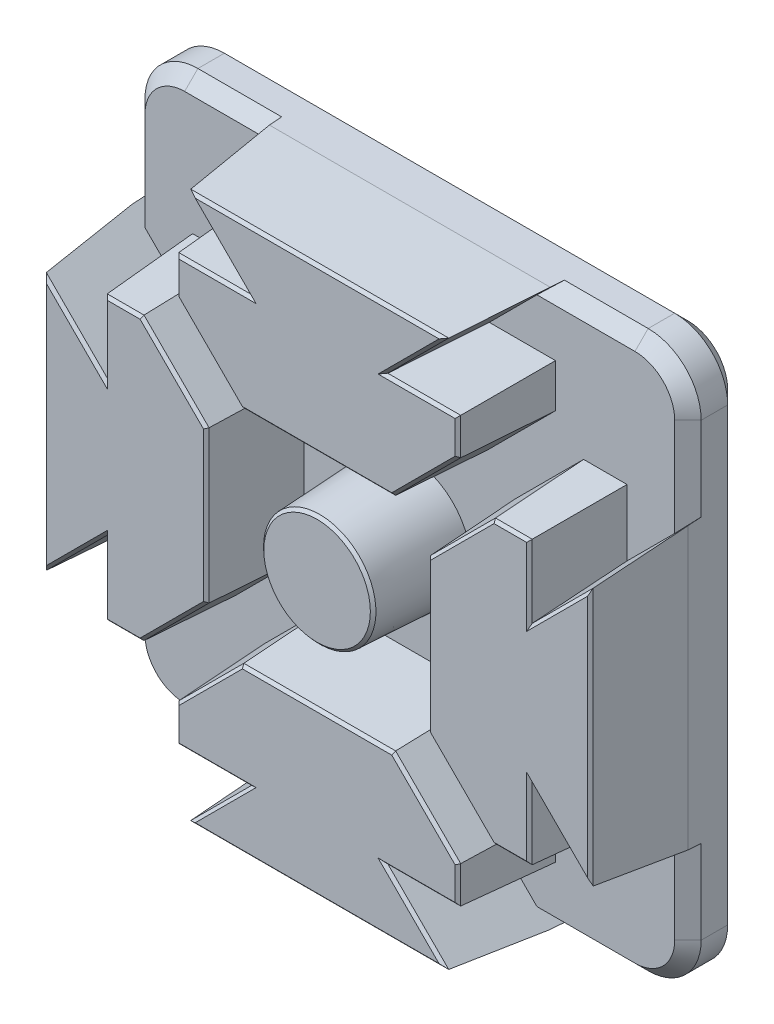
from build123d import *
from OCP.BRepFilletAPI import BRepFilletAPI_MakeChamfer

# Parameters (mm, degrees)
RESSALTO_EXTRUS_O1_DEPTH           = 2
ESBO_O4_R                          = 2.3
RESSALTO_EXTRUS_O2_DEPTH           = 3.5
RESSALTO_EXTRUS_O2_DRAFT           = 3
RESSALTO_EXTRUS_O2_PROFILE_2_DEPTH = 3.5
RESSALTO_EXTRUS_O2_PROFILE_2_DRAFT = 3
RESSALTO_EXTRUS_O2_PROFILE_3_DEPTH = 3.5
RESSALTO_EXTRUS_O2_PROFILE_3_DRAFT = 3
RESSALTO_EXTRUS_O2_PROFILE_4_DEPTH = 3.5
RESSALTO_EXTRUS_O2_PROFILE_4_DRAFT = 3
RESSALTO_EXTRUS_O2_PROFILE_5_DEPTH = 3.5
RESSALTO_EXTRUS_O2_PROFILE_5_DRAFT = 3
CHANFRO1_SIZE                      = 0.5
CHANFRO2_SIZE                      = 0.1
CHANFRO2_SIZE2                     = 0.10567545


with BuildPart() as part:
    # Esboço1 → Ressalto-extrusão1 (new body)
    with BuildSketch(Plane.XY):
        with BuildLine():
            Line((-8.5, -10.5), (8.5, -10.5))
            ThreePointArc((8.5, -10.5), (9.914213562, -9.914213562), (10.5, -8.5))
            Line((10.5, -8.5), (10.5, 8.5))
            ThreePointArc((10.5, 8.5), (9.914213562, 9.914213562), (8.5, 10.5))
            Line((8.5, 10.5), (-8.5, 10.5))
            ThreePointArc((-8.5, 10.5), (-9.914213562, 9.914213562), (-10.5, 8.5))
            Line((-10.5, 8.5), (-10.5, -8.5))
            ThreePointArc((-10.5, -8.5), (-9.914213562, -9.914213562), (-8.5, -10.5))
        make_face()
    extrude(amount=RESSALTO_EXTRUS_O1_DEPTH)


with BuildPart() as ressalto_extrus_o2_tool:
    # Esboço4 → Ressalto-extrusão2 (with draft: the straight prism first)
    with BuildSketch(Plane.XY.offset(2)):
        Circle(ESBO_O4_R)
    extrude(amount=RESSALTO_EXTRUS_O2_DEPTH)
    # Ressalto-extrusão2: the draft: its side faces are tilted about the plane it starts from
    ressalto_extrus_o2_sides = [ressalto_extrus_o2_tool.faces().sort_by_distance(p)[0] for p in [
        (-2.3, 0, 3.75),
    ]]
    draft(ressalto_extrus_o2_sides, Plane.XY.offset(2), RESSALTO_EXTRUS_O2_DRAFT)


with BuildPart() as part_1:
    add(part.part)

    # Ressalto-extrusão2: add ressalto_extrus_o2_tool
    add(ressalto_extrus_o2_tool.part)


with BuildPart() as ressalto_extrus_o2_profile_2_tool:
    # Esboço4 → Ressalto-extrusão2 profile 2 (with draft: the straight prism first)
    with BuildSketch(Plane.XY.offset(2)):
        Polygon((-5.3, 10.5), (-3, 8.2), (-5.5, 8.2), (-5.5, 6.560660172), (-2.939339828, 4), (0.3, 4), (2.939339828, 4), (5.5, 6.560660172), (5.5, 8.2), (3, 8.2), (5.3, 10.5), align=None)
    extrude(amount=RESSALTO_EXTRUS_O2_PROFILE_2_DEPTH)
    # Ressalto-extrusão2 profile 2: the draft: its side faces are tilted about the plane it starts from
    ressalto_extrus_o2_profile_2_sides = [ressalto_extrus_o2_profile_2_tool.faces().sort_by_distance(p)[0] for p in [
        (-4.15, 9.35, 3.75),
        (4.15, 9.35, 3.75),
        (4.25, 8.2, 3.75),
        (5.5, 7.380330086, 3.75),
        (4.219669914, 5.280330086, 3.75),
        (0, 4, 3.75),
        (-4.219669914, 5.280330086, 3.75),
        (-5.5, 7.380330086, 3.75),
        (-4.25, 8.2, 3.75),
        (0, 10.5, 3.75),
    ]]
    draft(ressalto_extrus_o2_profile_2_sides, Plane.XY.offset(2), RESSALTO_EXTRUS_O2_PROFILE_2_DRAFT)


with BuildPart() as part_2:
    add(part_1.part)

    # Ressalto-extrusão2 profile 2: add ressalto_extrus_o2_profile_2_tool
    add(ressalto_extrus_o2_profile_2_tool.part)


with BuildPart() as ressalto_extrus_o2_profile_3_tool:
    # Esboço4 → Ressalto-extrusão2 profile 3 (with draft: the straight prism first)
    with BuildSketch(Plane.XY.offset(2)):
        Polygon((10.5, 5.3), (8.2, 3), (8.2, 5.5), (6.560660172, 5.5), (4, 2.939339828), (4, -0.3), (4, -2.939339828), (6.560660172, -5.5), (8.2, -5.5), (8.2, -3), (10.5, -5.3), align=None)
    extrude(amount=RESSALTO_EXTRUS_O2_PROFILE_3_DEPTH)
    # Ressalto-extrusão2 profile 3: the draft: its side faces are tilted about the plane it starts from
    ressalto_extrus_o2_profile_3_sides = [ressalto_extrus_o2_profile_3_tool.faces().sort_by_distance(p)[0] for p in [
        (9.35, 4.15, 3.75),
        (9.35, -4.15, 3.75),
        (8.2, -4.25, 3.75),
        (7.380330086, -5.5, 3.75),
        (5.280330086, -4.219669914, 3.75),
        (4, 0, 3.75),
        (5.280330086, 4.219669914, 3.75),
        (7.380330086, 5.5, 3.75),
        (8.2, 4.25, 3.75),
        (10.5, 0, 3.75),
    ]]
    draft(ressalto_extrus_o2_profile_3_sides, Plane.XY.offset(2), RESSALTO_EXTRUS_O2_PROFILE_3_DRAFT)


with BuildPart() as part_3:
    add(part_2.part)

    # Ressalto-extrusão2 profile 3: add ressalto_extrus_o2_profile_3_tool
    add(ressalto_extrus_o2_profile_3_tool.part)


with BuildPart() as ressalto_extrus_o2_profile_4_tool:
    # Esboço4 → Ressalto-extrusão2 profile 4 (with draft: the straight prism first)
    with BuildSketch(Plane.XY.offset(2)):
        Polygon((5.3, -10.5), (3, -8.2), (5.5, -8.2), (5.5, -6.560660172), (2.939339828, -4), (-0.3, -4), (-2.939339828, -4), (-5.5, -6.560660172), (-5.5, -8.2), (-3, -8.2), (-5.3, -10.5), align=None)
    extrude(amount=RESSALTO_EXTRUS_O2_PROFILE_4_DEPTH)
    # Ressalto-extrusão2 profile 4: the draft: its side faces are tilted about the plane it starts from
    ressalto_extrus_o2_profile_4_sides = [ressalto_extrus_o2_profile_4_tool.faces().sort_by_distance(p)[0] for p in [
        (4.15, -9.35, 3.75),
        (-4.15, -9.35, 3.75),
        (-4.25, -8.2, 3.75),
        (-5.5, -7.380330086, 3.75),
        (-4.219669914, -5.280330086, 3.75),
        (0, -4, 3.75),
        (4.219669914, -5.280330086, 3.75),
        (5.5, -7.380330086, 3.75),
        (4.25, -8.2, 3.75),
        (0, -10.5, 3.75),
    ]]
    draft(ressalto_extrus_o2_profile_4_sides, Plane.XY.offset(2), RESSALTO_EXTRUS_O2_PROFILE_4_DRAFT)


with BuildPart() as part_4:
    add(part_3.part)

    # Ressalto-extrusão2 profile 4: add ressalto_extrus_o2_profile_4_tool
    add(ressalto_extrus_o2_profile_4_tool.part)


with BuildPart() as ressalto_extrus_o2_profile_5_tool:
    # Esboço4 → Ressalto-extrusão2 profile 5 (with draft: the straight prism first)
    with BuildSketch(Plane.XY.offset(2)):
        Polygon((-10.5, -5.3), (-8.2, -3), (-8.2, -5.5), (-6.560660172, -5.5), (-4, -2.939339828), (-4, 0.3), (-4, 2.939339828), (-6.560660172, 5.5), (-8.2, 5.5), (-8.2, 3), (-10.5, 5.3), align=None)
    extrude(amount=RESSALTO_EXTRUS_O2_PROFILE_5_DEPTH)
    # Ressalto-extrusão2 profile 5: the draft: its side faces are tilted about the plane it starts from
    ressalto_extrus_o2_profile_5_sides = [ressalto_extrus_o2_profile_5_tool.faces().sort_by_distance(p)[0] for p in [
        (-9.35, -4.15, 3.75),
        (-9.35, 4.15, 3.75),
        (-8.2, 4.25, 3.75),
        (-7.380330086, 5.5, 3.75),
        (-5.280330086, 4.219669914, 3.75),
        (-4, 0, 3.75),
        (-5.280330086, -4.219669914, 3.75),
        (-7.380330086, -5.5, 3.75),
        (-8.2, -4.25, 3.75),
        (-10.5, 0, 3.75),
    ]]
    draft(ressalto_extrus_o2_profile_5_sides, Plane.XY.offset(2), RESSALTO_EXTRUS_O2_PROFILE_5_DRAFT)


with BuildPart() as part_5:
    add(part_4.part)

    # Ressalto-extrusão2 profile 5: add ressalto_extrus_o2_profile_5_tool
    add(ressalto_extrus_o2_profile_5_tool.part)

    # Chanfro1
    # the kernel refuses this chamfer: 0.5 mm, written as the material it takes off along each edge
    with BuildSketch(Plane(origin=(10.5, -8.5, 0), x_dir=(-0.9996219169112968, 0, -0.02749587661058639), z_dir=(0, 1, 0)), Plane(origin=(-10.5, 8.5, 0), x_dir=(0.9996219169112968, 0, -0.02749587661058639), z_dir=(0, -1, 0)), Plane(origin=(8.5, 10.5, 0), x_dir=(0, -0.9996219169112968, -0.02749587661058639), z_dir=(-1, 0, 0))) as chanfro1_piece_1:
        Polygon((CHANFRO1_SIZE * 0.999621916911, CHANFRO1_SIZE * 0.0274958766106), (-CHANFRO1_SIZE * 0.0274958766106, CHANFRO1_SIZE * 0.999621916911), (0, 0), align=None)
    extrude(amount=17, mode=Mode.SUBTRACT)
    with BuildSketch(Plane(origin=(10.5, 4.014158506, 2), x_dir=(-0.9996219169112968, 0, 0.02749587661058651), z_dir=(0, 1, 0))) as chanfro1_piece_2_section:
        Polygon((CHANFRO1_SIZE * 0.999621916911, -CHANFRO1_SIZE * 0.0274958766106), (-CHANFRO1_SIZE * 0.0274958766106, -CHANFRO1_SIZE * 0.999621916911), (0, 0), align=None)
    chanfro1_piece_2 = extrude(amount=4.485841494, mode=Mode.PRIVATE)
    chanfro1_piece_2 = split(chanfro1_piece_2, bisect_by=Plane(origin=(10.997071922, 5.813280142, 1.781312186), z_dir=(-0.7061377159181261, 0.7061377159181265, 0.05233595624294392)), keep=Keep.TOP, mode=Mode.PRIVATE)
    add(chanfro1_piece_2, mode=Mode.SUBTRACT)
    with BuildSketch(Plane(origin=(8.5, -8.5, 0), x_dir=(0, -1, 0), z_dir=(-1, 0, 0))) as chanfro1_piece_3:
        Polygon((2, CHANFRO1_SIZE), (2 - CHANFRO1_SIZE, 0), (2, 0), align=None)
    revolve(axis=Axis((8.5, -8.5, 0), (0, 0, 1)), revolution_arc=90, mode=Mode.SUBTRACT)
    with BuildSketch(Plane(origin=(-8.5, -10.5, 0), x_dir=(0, -0.02749587661058563, 0.9996219169112968), z_dir=(1, 0, 0))) as chanfro1_piece_4:
        Polygon((CHANFRO1_SIZE * 0.999621916911, -CHANFRO1_SIZE * 0.0274958766106), (-CHANFRO1_SIZE * 0.0274958766106, -CHANFRO1_SIZE * 0.999621916911), (0, 0), align=None)
    extrude(amount=17, mode=Mode.SUBTRACT)
    with BuildSketch(Plane(origin=(-8.5, -8.5, 0), x_dir=(-1, 0, 0), z_dir=(0, 1, 0))) as chanfro1_piece_5:
        Polygon((2, CHANFRO1_SIZE), (2 - CHANFRO1_SIZE, 0), (2, 0), align=None)
    revolve(axis=Axis((-8.5, -8.5, 0), (0, 0, 1)), revolution_arc=90, mode=Mode.SUBTRACT)
    with BuildSketch(Plane(origin=(8.5, -8.5, 2), x_dir=(0, -1, 0), z_dir=(-1, 0, 0))) as chanfro1_piece_6:
        Polygon((2, -CHANFRO1_SIZE), (2 - CHANFRO1_SIZE, 0), (2, 0), align=None)
    revolve(axis=Axis((8.5, -8.5, 2), (0, 0, 1)), revolution_arc=90, mode=Mode.SUBTRACT)
    with BuildSketch(Plane(origin=(10.5, -8.5, 2), x_dir=(-0.9996219169112968, 0, 0.02749587661058651), z_dir=(0, 1, 0))) as chanfro1_piece_7_section:
        Polygon((CHANFRO1_SIZE * 0.999621916911, -CHANFRO1_SIZE * 0.0274958766106), (-CHANFRO1_SIZE * 0.0274958766106, -CHANFRO1_SIZE * 0.999621916911), (0, 0), align=None)
    chanfro1_piece_7 = extrude(amount=4.485841494, mode=Mode.PRIVATE)
    chanfro1_piece_7 = split(chanfro1_piece_7, bisect_by=Plane(origin=(11.771386688, -6.590192519, 1.746264181), z_dir=(-0.706137715918157, -0.7061377159180956, 0.052335956242943925)), keep=Keep.TOP, mode=Mode.PRIVATE)
    add(chanfro1_piece_7, mode=Mode.SUBTRACT)
    with BuildSketch(Plane(origin=(8.5, 8.5, 2), x_dir=(1, 0, 0), z_dir=(0, -1, 0))) as chanfro1_piece_8:
        Polygon((2 - CHANFRO1_SIZE, 0), (2, -CHANFRO1_SIZE), (2, 0), align=None)
    revolve(axis=Axis((8.5, 8.5, 2), (0, 0, 1)), revolution_arc=90, mode=Mode.SUBTRACT)
    with BuildSketch(Plane(origin=(8.5, 10.5, 2), x_dir=(0, -0.9996219169112968, 0.02749587661058651), z_dir=(-1, 0, 0))) as chanfro1_piece_9_section:
        Polygon((CHANFRO1_SIZE * 0.999621916911, -CHANFRO1_SIZE * 0.0274958766106), (-CHANFRO1_SIZE * 0.0274958766106, -CHANFRO1_SIZE * 0.999621916911), (0, 0), align=None)
    chanfro1_piece_9 = extrude(amount=4.485841494, mode=Mode.PRIVATE)
    chanfro1_piece_9 = split(chanfro1_piece_9, bisect_by=Plane(origin=(6.590192519, 11.771386688, 1.746264181), z_dir=(0.706137715918126, -0.7061377159181266, 0.05233595624294391)), keep=Keep.TOP, mode=Mode.PRIVATE)
    add(chanfro1_piece_9, mode=Mode.SUBTRACT)
    with BuildSketch(Plane(origin=(4.014158506, -10.5, 2), x_dir=(0, -0.027495876610585623, -0.9996219169112968), z_dir=(1, 0, 0))) as chanfro1_piece_10_section:
        Polygon((CHANFRO1_SIZE * 0.999621916911, CHANFRO1_SIZE * 0.0274958766106), (-CHANFRO1_SIZE * 0.0274958766106, CHANFRO1_SIZE * 0.999621916911), (0, 0), align=None)
    chanfro1_piece_10 = extrude(amount=4.485841494, mode=Mode.PRIVATE)
    chanfro1_piece_10 = split(chanfro1_piece_10, bisect_by=Plane(origin=(5.813280142, -10.997071922, 1.781312186), z_dir=(0.7061377159181261, 0.7061377159181265, 0.05233595624294392)), keep=Keep.TOP, mode=Mode.PRIVATE)
    add(chanfro1_piece_10, mode=Mode.SUBTRACT)
    with BuildSketch(Plane(origin=(-8.5, 8.5, 2), x_dir=(0, 1, 0), z_dir=(1, 0, 0))) as chanfro1_piece_11:
        Polygon((2 - CHANFRO1_SIZE, 0), (2, -CHANFRO1_SIZE), (2, 0), align=None)
    revolve(axis=Axis((-8.5, 8.5, 2), (0, 0, 1)), revolution_arc=90, mode=Mode.SUBTRACT)
    with BuildSketch(Plane(origin=(-10.5, 8.5, 2), x_dir=(0.9996219169112968, 0, 0.02749587661058651), z_dir=(0, -1, 0))) as chanfro1_piece_12_section:
        Polygon((CHANFRO1_SIZE * 0.999621916911, -CHANFRO1_SIZE * 0.0274958766106), (-CHANFRO1_SIZE * 0.0274958766106, -CHANFRO1_SIZE * 0.999621916911), (0, 0), align=None)
    chanfro1_piece_12 = extrude(amount=4.485841494, mode=Mode.PRIVATE)
    chanfro1_piece_12 = split(chanfro1_piece_12, bisect_by=Plane(origin=(-11.771386688, 6.590192519, 1.746264181), z_dir=(0.7061377159181257, 0.7061377159181269, 0.05233595624294392)), keep=Keep.TOP, mode=Mode.PRIVATE)
    add(chanfro1_piece_12, mode=Mode.SUBTRACT)
    with BuildSketch(Plane(origin=(-8.5, -8.5, 2), x_dir=(-1, 0, 0), z_dir=(0, 1, 0))) as chanfro1_piece_13:
        Polygon((2, -CHANFRO1_SIZE), (2 - CHANFRO1_SIZE, 0), (2, 0), align=None)
    revolve(axis=Axis((-8.5, -8.5, 2), (0, 0, 1)), revolution_arc=90, mode=Mode.SUBTRACT)
    with BuildSketch(Plane(origin=(-10.5, -4.014158506, 2), x_dir=(0.9996219169112968, 0, 0.02749587661058651), z_dir=(0, -1, 0))) as chanfro1_piece_14_section:
        Polygon((CHANFRO1_SIZE * 0.999621916911, -CHANFRO1_SIZE * 0.0274958766106), (-CHANFRO1_SIZE * 0.0274958766106, -CHANFRO1_SIZE * 0.999621916911), (0, 0), align=None)
    chanfro1_piece_14 = extrude(amount=4.485841494, mode=Mode.PRIVATE)
    chanfro1_piece_14 = split(chanfro1_piece_14, bisect_by=Plane(origin=(-10.997071922, -5.813280142, 1.781312186), z_dir=(0.7061377159181217, -0.7061377159181309, 0.05233595624294392)), keep=Keep.TOP, mode=Mode.PRIVATE)
    add(chanfro1_piece_14, mode=Mode.SUBTRACT)
    with BuildSketch(Plane(origin=(-4.014158506, 10.5, 2), x_dir=(0, -0.9996219169112968, 0.02749587661058651), z_dir=(-1, 0, 0))) as chanfro1_piece_15_section:
        Polygon((CHANFRO1_SIZE * 0.999621916911, -CHANFRO1_SIZE * 0.0274958766106), (-CHANFRO1_SIZE * 0.0274958766106, -CHANFRO1_SIZE * 0.999621916911), (0, 0), align=None)
    chanfro1_piece_15 = extrude(amount=4.485841494, mode=Mode.PRIVATE)
    chanfro1_piece_15 = split(chanfro1_piece_15, bisect_by=Plane(origin=(-5.813280142, 10.997071922, 1.781312186), z_dir=(-0.7061377159181261, -0.7061377159181265, 0.05233595624294392)), keep=Keep.TOP, mode=Mode.PRIVATE)
    add(chanfro1_piece_15, mode=Mode.SUBTRACT)
    with BuildSketch(Plane(origin=(-8.5, -10.5, 2), x_dir=(0, -0.027495876610585623, -0.9996219169112968), z_dir=(1, 0, 0))) as chanfro1_piece_16_section:
        Polygon((CHANFRO1_SIZE * 0.999621916911, CHANFRO1_SIZE * 0.0274958766106), (-CHANFRO1_SIZE * 0.0274958766106, CHANFRO1_SIZE * 0.999621916911), (0, 0), align=None)
    chanfro1_piece_16 = extrude(amount=4.485841494, mode=Mode.PRIVATE)
    chanfro1_piece_16 = split(chanfro1_piece_16, bisect_by=Plane(origin=(-5.813280144, -10.997071923, 1.781312186), z_dir=(-0.7061377159181254, 0.7061377159181271, 0.052335956242943904)), keep=Keep.TOP, mode=Mode.PRIVATE)
    add(chanfro1_piece_16, mode=Mode.SUBTRACT)
    with BuildSketch(Plane(origin=(-8.5, 8.5, 0), x_dir=(0, 1, 0), z_dir=(1, 0, 0))) as chanfro1_piece_17:
        Polygon((2 - CHANFRO1_SIZE, 0), (2, CHANFRO1_SIZE), (2, 0), align=None)
    revolve(axis=Axis((-8.5, 8.5, 0), (0, 0, 1)), revolution_arc=90, mode=Mode.SUBTRACT)
    with BuildSketch(Plane(origin=(8.5, 8.5, 0), x_dir=(1, 0, 0), z_dir=(0, -1, 0))) as chanfro1_piece_18:
        Polygon((2 - CHANFRO1_SIZE, 0), (2, CHANFRO1_SIZE), (2, 0), align=None)
    revolve(axis=Axis((8.5, 8.5, 0), (0, 0, 1)), revolution_arc=90, mode=Mode.SUBTRACT)

    # Chanfro2: one chamfer whose edges measure the first distance from different faces: ONE call of the kernel's chamfer builder (chamfer() names one face for all edges)
    chanfro2_edges_1 = [part_5.edges().sort_by_distance(p)[0] for p in [
        (9.166572773, 3.7071675, 5.5),
    ]]
    chanfro2_side_1 = [part_5.faces().sort_by_distance(p)[0] for p in [
        (9.274724413, 3.947193875, 3.72069317),
    ]]
    chanfro2_edges_2 = [part_5.edges().sort_by_distance(p)[0] for p in [
        (8.016572773, 3.936870136, 5.5),
    ]]
    chanfro2_side_2 = [part_5.faces().sort_by_distance(p)[0] for p in [
        (8.106778548, 4.090861027, 3.778771265),
    ]]
    chanfro2_edges_3 = [part_5.edges().sort_by_distance(p)[0] for p in [
        (7.326605495, 5.316572773, 5.5),
    ]]
    chanfro2_side_3 = [part_5.faces().sort_by_distance(p)[0] for p in [
        (7.354237095, 5.410912955, 3.699882083),
    ]]
    chanfro2_edges_4 = [part_5.edges().sort_by_distance(p)[0] for p in [
        (5.410032722, 4.089967278, 5.5),
    ]]
    chanfro2_side_4 = [part_5.faces().sort_by_distance(p)[0] for p in [
        (5.344718141, 4.155281859, 3.737498943),
    ]]
    chanfro2_edges_5 = [part_5.edges().sort_by_distance(p)[0] for p in [
        (4.183427227, 0, 5.5),
    ]]
    chanfro2_side_5 = [part_5.faces().sort_by_distance(p)[0] for p in [
        (4.091313328, 0, 3.742362088),
    ]]
    chanfro2_edges_6 = [part_5.edges().sort_by_distance(p)[0] for p in [
        (5.410032722, -4.089967278, 5.5),
    ]]
    chanfro2_side_6 = [part_5.faces().sort_by_distance(p)[0] for p in [
        (5.344718141, -4.155281859, 3.737498943),
    ]]
    chanfro2_edges_7 = [part_5.edges().sort_by_distance(p)[0] for p in [
        (7.326605495, -5.316572773, 5.5),
    ]]
    chanfro2_side_7 = [part_5.faces().sort_by_distance(p)[0] for p in [
        (7.354237095, -5.410912955, 3.699882083),
    ]]
    chanfro2_edges_8 = [part_5.edges().sort_by_distance(p)[0] for p in [
        (8.016572773, -3.936870136, 5.5),
    ]]
    chanfro2_side_8 = [part_5.faces().sort_by_distance(p)[0] for p in [
        (8.106778548, -4.090861027, 3.778771265),
    ]]
    chanfro2_edges_9 = [part_5.edges().sort_by_distance(p)[0] for p in [
        (9.166572773, -3.7071675, 5.5),
    ]]
    chanfro2_side_9 = [part_5.faces().sort_by_distance(p)[0] for p in [
        (9.274724413, -3.947193875, 3.72069317),
    ]]
    chanfro2_edges_10 = [part_5.edges().sort_by_distance(p)[0] for p in [
        (10.316572773, 0, 5.5),
    ]]
    chanfro2_side_10 = [part_5.faces().sort_by_distance(p)[0] for p in [
        (10.409619231, 0, 3.724567815),
    ]]
    chanfro2_edges_11 = [part_5.edges().sort_by_distance(p)[0] for p in [
        (0, -4.183427227, 5.5),
    ]]
    chanfro2_side_11 = [part_5.faces().sort_by_distance(p)[0] for p in [
        (0, -4.091313328, 3.742362088),
    ]]
    chanfro2_edges_12 = [part_5.edges().sort_by_distance(p)[0] for p in [
        (-4.089967278, -5.410032722, 5.5),
    ]]
    chanfro2_side_12 = [part_5.faces().sort_by_distance(p)[0] for p in [
        (-4.155281859, -5.344718141, 3.737498943),
    ]]
    chanfro2_edges_13 = [part_5.edges().sort_by_distance(p)[0] for p in [
        (-5.316572773, -7.326605495, 5.5),
    ]]
    chanfro2_side_13 = [part_5.faces().sort_by_distance(p)[0] for p in [
        (-5.410912955, -7.354237095, 3.699882083),
    ]]
    chanfro2_edges_14 = [part_5.edges().sort_by_distance(p)[0] for p in [
        (-3.936870136, -8.016572773, 5.5),
    ]]
    chanfro2_side_14 = [part_5.faces().sort_by_distance(p)[0] for p in [
        (-4.090861027, -8.106778548, 3.778771265),
    ]]
    chanfro2_edges_15 = [part_5.edges().sort_by_distance(p)[0] for p in [
        (-3.7071675, -9.166572773, 5.5),
    ]]
    chanfro2_side_15 = [part_5.faces().sort_by_distance(p)[0] for p in [
        (-3.947193875, -9.274724413, 3.72069317),
    ]]
    chanfro2_edges_16 = [part_5.edges().sort_by_distance(p)[0] for p in [
        (0, -10.316572773, 5.5),
    ]]
    chanfro2_side_16 = [part_5.faces().sort_by_distance(p)[0] for p in [
        (0, -10.409619231, 3.724567815),
    ]]
    chanfro2_edges_17 = [part_5.edges().sort_by_distance(p)[0] for p in [
        (3.7071675, -9.166572773, 5.5),
    ]]
    chanfro2_side_17 = [part_5.faces().sort_by_distance(p)[0] for p in [
        (3.947193875, -9.274724413, 3.72069317),
    ]]
    chanfro2_edges_18 = [part_5.edges().sort_by_distance(p)[0] for p in [
        (3.936870136, -8.016572773, 5.5),
    ]]
    chanfro2_side_18 = [part_5.faces().sort_by_distance(p)[0] for p in [
        (4.090861027, -8.106778548, 3.778771265),
    ]]
    chanfro2_edges_19 = [part_5.edges().sort_by_distance(p)[0] for p in [
        (5.316572773, -7.326605495, 5.5),
    ]]
    chanfro2_side_19 = [part_5.faces().sort_by_distance(p)[0] for p in [
        (5.410912955, -7.354237095, 3.699882083),
    ]]
    chanfro2_edges_20 = [part_5.edges().sort_by_distance(p)[0] for p in [
        (4.089967278, -5.410032722, 5.5),
    ]]
    chanfro2_side_20 = [part_5.faces().sort_by_distance(p)[0] for p in [
        (4.155281859, -5.344718141, 3.737498943),
    ]]
    chanfro2_edges_21 = [part_5.edges().sort_by_distance(p)[0] for p in [
        (-2.116572773, 0, 5.5),
    ]]
    chanfro2_side_21 = [part_5.faces().sort_by_distance(p)[0] for p in [
        (-2.208286386, 0, 3.75),
    ]]
    chanfro2_edges_22 = [part_5.edges().sort_by_distance(p)[0] for p in [
        (-9.166572773, -3.7071675, 5.5),
    ]]
    chanfro2_side_22 = [part_5.faces().sort_by_distance(p)[0] for p in [
        (-9.274724413, -3.947193875, 3.72069317),
    ]]
    chanfro2_edges_23 = [part_5.edges().sort_by_distance(p)[0] for p in [
        (-8.016572773, -3.936870136, 5.5),
    ]]
    chanfro2_side_23 = [part_5.faces().sort_by_distance(p)[0] for p in [
        (-8.106778548, -4.090861027, 3.778771265),
    ]]
    chanfro2_edges_24 = [part_5.edges().sort_by_distance(p)[0] for p in [
        (-7.326605495, -5.316572773, 5.5),
    ]]
    chanfro2_side_24 = [part_5.faces().sort_by_distance(p)[0] for p in [
        (-7.354237095, -5.410912955, 3.699882083),
    ]]
    chanfro2_edges_25 = [part_5.edges().sort_by_distance(p)[0] for p in [
        (-5.410032722, -4.089967278, 5.5),
    ]]
    chanfro2_side_25 = [part_5.faces().sort_by_distance(p)[0] for p in [
        (-5.344718141, -4.155281859, 3.737498943),
    ]]
    chanfro2_edges_26 = [part_5.edges().sort_by_distance(p)[0] for p in [
        (-4.183427227, 0, 5.5),
    ]]
    chanfro2_side_26 = [part_5.faces().sort_by_distance(p)[0] for p in [
        (-4.091313328, 0, 3.742362088),
    ]]
    chanfro2_edges_27 = [part_5.edges().sort_by_distance(p)[0] for p in [
        (-5.410032722, 4.089967278, 5.5),
    ]]
    chanfro2_side_27 = [part_5.faces().sort_by_distance(p)[0] for p in [
        (-5.344718141, 4.155281859, 3.737498943),
    ]]
    chanfro2_edges_28 = [part_5.edges().sort_by_distance(p)[0] for p in [
        (-7.326605495, 5.316572773, 5.5),
    ]]
    chanfro2_side_28 = [part_5.faces().sort_by_distance(p)[0] for p in [
        (-7.354237095, 5.410912955, 3.699882083),
    ]]
    chanfro2_edges_29 = [part_5.edges().sort_by_distance(p)[0] for p in [
        (-8.016572773, 3.936870136, 5.5),
    ]]
    chanfro2_side_29 = [part_5.faces().sort_by_distance(p)[0] for p in [
        (-8.106778548, 4.090861027, 3.778771265),
    ]]
    chanfro2_edges_30 = [part_5.edges().sort_by_distance(p)[0] for p in [
        (-9.166572773, 3.7071675, 5.5),
    ]]
    chanfro2_side_30 = [part_5.faces().sort_by_distance(p)[0] for p in [
        (-9.274724413, 3.947193875, 3.72069317),
    ]]
    chanfro2_edges_31 = [part_5.edges().sort_by_distance(p)[0] for p in [
        (-10.316572773, 0, 5.5),
    ]]
    chanfro2_side_31 = [part_5.faces().sort_by_distance(p)[0] for p in [
        (-10.409619231, 0, 3.724567815),
    ]]
    chanfro2_edges_32 = [part_5.edges().sort_by_distance(p)[0] for p in [
        (-3.7071675, 9.166572773, 5.5),
    ]]
    chanfro2_side_32 = [part_5.faces().sort_by_distance(p)[0] for p in [
        (-3.947193875, 9.274724413, 3.72069317),
    ]]
    chanfro2_edges_33 = [part_5.edges().sort_by_distance(p)[0] for p in [
        (-3.936870136, 8.016572773, 5.5),
    ]]
    chanfro2_side_33 = [part_5.faces().sort_by_distance(p)[0] for p in [
        (-4.090861027, 8.106778548, 3.778771265),
    ]]
    chanfro2_edges_34 = [part_5.edges().sort_by_distance(p)[0] for p in [
        (-5.316572773, 7.326605495, 5.5),
    ]]
    chanfro2_side_34 = [part_5.faces().sort_by_distance(p)[0] for p in [
        (-5.410912955, 7.354237095, 3.699882083),
    ]]
    chanfro2_edges_35 = [part_5.edges().sort_by_distance(p)[0] for p in [
        (-4.089967278, 5.410032722, 5.5),
    ]]
    chanfro2_side_35 = [part_5.faces().sort_by_distance(p)[0] for p in [
        (-4.155281859, 5.344718141, 3.737498943),
    ]]
    chanfro2_edges_36 = [part_5.edges().sort_by_distance(p)[0] for p in [
        (0, 4.183427227, 5.5),
    ]]
    chanfro2_side_36 = [part_5.faces().sort_by_distance(p)[0] for p in [
        (0, 4.091313328, 3.742362088),
    ]]
    chanfro2_edges_37 = [part_5.edges().sort_by_distance(p)[0] for p in [
        (4.089967278, 5.410032722, 5.5),
    ]]
    chanfro2_side_37 = [part_5.faces().sort_by_distance(p)[0] for p in [
        (4.155281859, 5.344718141, 3.737498943),
    ]]
    chanfro2_edges_38 = [part_5.edges().sort_by_distance(p)[0] for p in [
        (5.316572773, 7.326605495, 5.5),
    ]]
    chanfro2_side_38 = [part_5.faces().sort_by_distance(p)[0] for p in [
        (5.410912955, 7.354237095, 3.699882083),
    ]]
    chanfro2_edges_39 = [part_5.edges().sort_by_distance(p)[0] for p in [
        (3.936870136, 8.016572773, 5.5),
    ]]
    chanfro2_side_39 = [part_5.faces().sort_by_distance(p)[0] for p in [
        (4.090861027, 8.106778548, 3.778771265),
    ]]
    chanfro2_edges_40 = [part_5.edges().sort_by_distance(p)[0] for p in [
        (3.7071675, 9.166572773, 5.5),
    ]]
    chanfro2_side_40 = [part_5.faces().sort_by_distance(p)[0] for p in [
        (3.947193875, 9.274724413, 3.72069317),
    ]]
    chanfro2_edges_41 = [part_5.edges().sort_by_distance(p)[0] for p in [
        (0, 10.316572773, 5.5),
    ]]
    chanfro2_side_41 = [part_5.faces().sort_by_distance(p)[0] for p in [
        (0, 10.409619231, 3.724567815),
    ]]
    chanfro2 = BRepFilletAPI_MakeChamfer(part_5.part.solid().wrapped)
    for e in chanfro2_edges_1:
        chanfro2.Add(CHANFRO2_SIZE, CHANFRO2_SIZE2, e.wrapped, chanfro2_side_1[0].wrapped)  # the first distance lies on this face
    for e in chanfro2_edges_2:
        chanfro2.Add(CHANFRO2_SIZE, CHANFRO2_SIZE2, e.wrapped, chanfro2_side_2[0].wrapped)  # the first distance lies on this face
    for e in chanfro2_edges_3:
        chanfro2.Add(CHANFRO2_SIZE, CHANFRO2_SIZE2, e.wrapped, chanfro2_side_3[0].wrapped)  # the first distance lies on this face
    for e in chanfro2_edges_4:
        chanfro2.Add(CHANFRO2_SIZE, CHANFRO2_SIZE2, e.wrapped, chanfro2_side_4[0].wrapped)  # the first distance lies on this face
    for e in chanfro2_edges_5:
        chanfro2.Add(CHANFRO2_SIZE, CHANFRO2_SIZE2, e.wrapped, chanfro2_side_5[0].wrapped)  # the first distance lies on this face
    for e in chanfro2_edges_6:
        chanfro2.Add(CHANFRO2_SIZE, CHANFRO2_SIZE2, e.wrapped, chanfro2_side_6[0].wrapped)  # the first distance lies on this face
    for e in chanfro2_edges_7:
        chanfro2.Add(CHANFRO2_SIZE, CHANFRO2_SIZE2, e.wrapped, chanfro2_side_7[0].wrapped)  # the first distance lies on this face
    for e in chanfro2_edges_8:
        chanfro2.Add(CHANFRO2_SIZE, CHANFRO2_SIZE2, e.wrapped, chanfro2_side_8[0].wrapped)  # the first distance lies on this face
    for e in chanfro2_edges_9:
        chanfro2.Add(CHANFRO2_SIZE, CHANFRO2_SIZE2, e.wrapped, chanfro2_side_9[0].wrapped)  # the first distance lies on this face
    for e in chanfro2_edges_10:
        chanfro2.Add(CHANFRO2_SIZE, CHANFRO2_SIZE2, e.wrapped, chanfro2_side_10[0].wrapped)  # the first distance lies on this face
    for e in chanfro2_edges_11:
        chanfro2.Add(CHANFRO2_SIZE, CHANFRO2_SIZE2, e.wrapped, chanfro2_side_11[0].wrapped)  # the first distance lies on this face
    for e in chanfro2_edges_12:
        chanfro2.Add(CHANFRO2_SIZE, CHANFRO2_SIZE2, e.wrapped, chanfro2_side_12[0].wrapped)  # the first distance lies on this face
    for e in chanfro2_edges_13:
        chanfro2.Add(CHANFRO2_SIZE, CHANFRO2_SIZE2, e.wrapped, chanfro2_side_13[0].wrapped)  # the first distance lies on this face
    for e in chanfro2_edges_14:
        chanfro2.Add(CHANFRO2_SIZE, CHANFRO2_SIZE2, e.wrapped, chanfro2_side_14[0].wrapped)  # the first distance lies on this face
    for e in chanfro2_edges_15:
        chanfro2.Add(CHANFRO2_SIZE, CHANFRO2_SIZE2, e.wrapped, chanfro2_side_15[0].wrapped)  # the first distance lies on this face
    for e in chanfro2_edges_16:
        chanfro2.Add(CHANFRO2_SIZE, CHANFRO2_SIZE2, e.wrapped, chanfro2_side_16[0].wrapped)  # the first distance lies on this face
    for e in chanfro2_edges_17:
        chanfro2.Add(CHANFRO2_SIZE, CHANFRO2_SIZE2, e.wrapped, chanfro2_side_17[0].wrapped)  # the first distance lies on this face
    for e in chanfro2_edges_18:
        chanfro2.Add(CHANFRO2_SIZE, CHANFRO2_SIZE2, e.wrapped, chanfro2_side_18[0].wrapped)  # the first distance lies on this face
    for e in chanfro2_edges_19:
        chanfro2.Add(CHANFRO2_SIZE, CHANFRO2_SIZE2, e.wrapped, chanfro2_side_19[0].wrapped)  # the first distance lies on this face
    for e in chanfro2_edges_20:
        chanfro2.Add(CHANFRO2_SIZE, CHANFRO2_SIZE2, e.wrapped, chanfro2_side_20[0].wrapped)  # the first distance lies on this face
    for e in chanfro2_edges_21:
        chanfro2.Add(CHANFRO2_SIZE, CHANFRO2_SIZE2, e.wrapped, chanfro2_side_21[0].wrapped)  # the first distance lies on this face
    for e in chanfro2_edges_22:
        chanfro2.Add(CHANFRO2_SIZE, CHANFRO2_SIZE2, e.wrapped, chanfro2_side_22[0].wrapped)  # the first distance lies on this face
    for e in chanfro2_edges_23:
        chanfro2.Add(CHANFRO2_SIZE, CHANFRO2_SIZE2, e.wrapped, chanfro2_side_23[0].wrapped)  # the first distance lies on this face
    for e in chanfro2_edges_24:
        chanfro2.Add(CHANFRO2_SIZE, CHANFRO2_SIZE2, e.wrapped, chanfro2_side_24[0].wrapped)  # the first distance lies on this face
    for e in chanfro2_edges_25:
        chanfro2.Add(CHANFRO2_SIZE, CHANFRO2_SIZE2, e.wrapped, chanfro2_side_25[0].wrapped)  # the first distance lies on this face
    for e in chanfro2_edges_26:
        chanfro2.Add(CHANFRO2_SIZE, CHANFRO2_SIZE2, e.wrapped, chanfro2_side_26[0].wrapped)  # the first distance lies on this face
    for e in chanfro2_edges_27:
        chanfro2.Add(CHANFRO2_SIZE, CHANFRO2_SIZE2, e.wrapped, chanfro2_side_27[0].wrapped)  # the first distance lies on this face
    for e in chanfro2_edges_28:
        chanfro2.Add(CHANFRO2_SIZE, CHANFRO2_SIZE2, e.wrapped, chanfro2_side_28[0].wrapped)  # the first distance lies on this face
    for e in chanfro2_edges_29:
        chanfro2.Add(CHANFRO2_SIZE, CHANFRO2_SIZE2, e.wrapped, chanfro2_side_29[0].wrapped)  # the first distance lies on this face
    for e in chanfro2_edges_30:
        chanfro2.Add(CHANFRO2_SIZE, CHANFRO2_SIZE2, e.wrapped, chanfro2_side_30[0].wrapped)  # the first distance lies on this face
    for e in chanfro2_edges_31:
        chanfro2.Add(CHANFRO2_SIZE, CHANFRO2_SIZE2, e.wrapped, chanfro2_side_31[0].wrapped)  # the first distance lies on this face
    for e in chanfro2_edges_32:
        chanfro2.Add(CHANFRO2_SIZE, CHANFRO2_SIZE2, e.wrapped, chanfro2_side_32[0].wrapped)  # the first distance lies on this face
    for e in chanfro2_edges_33:
        chanfro2.Add(CHANFRO2_SIZE, CHANFRO2_SIZE2, e.wrapped, chanfro2_side_33[0].wrapped)  # the first distance lies on this face
    for e in chanfro2_edges_34:
        chanfro2.Add(CHANFRO2_SIZE, CHANFRO2_SIZE2, e.wrapped, chanfro2_side_34[0].wrapped)  # the first distance lies on this face
    for e in chanfro2_edges_35:
        chanfro2.Add(CHANFRO2_SIZE, CHANFRO2_SIZE2, e.wrapped, chanfro2_side_35[0].wrapped)  # the first distance lies on this face
    for e in chanfro2_edges_36:
        chanfro2.Add(CHANFRO2_SIZE, CHANFRO2_SIZE2, e.wrapped, chanfro2_side_36[0].wrapped)  # the first distance lies on this face
    for e in chanfro2_edges_37:
        chanfro2.Add(CHANFRO2_SIZE, CHANFRO2_SIZE2, e.wrapped, chanfro2_side_37[0].wrapped)  # the first distance lies on this face
    for e in chanfro2_edges_38:
        chanfro2.Add(CHANFRO2_SIZE, CHANFRO2_SIZE2, e.wrapped, chanfro2_side_38[0].wrapped)  # the first distance lies on this face
    for e in chanfro2_edges_39:
        chanfro2.Add(CHANFRO2_SIZE, CHANFRO2_SIZE2, e.wrapped, chanfro2_side_39[0].wrapped)  # the first distance lies on this face
    for e in chanfro2_edges_40:
        chanfro2.Add(CHANFRO2_SIZE, CHANFRO2_SIZE2, e.wrapped, chanfro2_side_40[0].wrapped)  # the first distance lies on this face
    for e in chanfro2_edges_41:
        chanfro2.Add(CHANFRO2_SIZE, CHANFRO2_SIZE2, e.wrapped, chanfro2_side_41[0].wrapped)  # the first distance lies on this face
    add(Compound.cast(chanfro2.Shape()), mode=Mode.REPLACE)


solid = part_5.part
